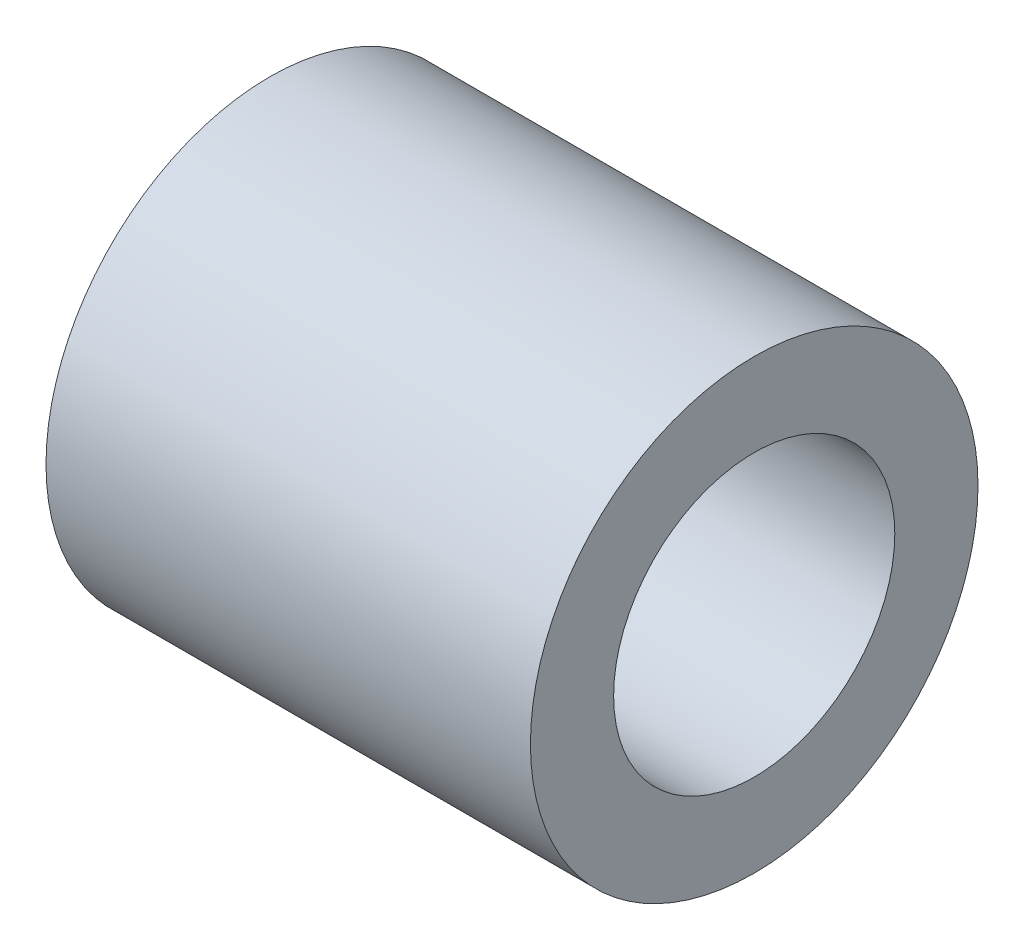
from build123d import *

# Parameters (mm, degrees)
SKETCH1_R           = 5.3975
SKETCH1_R_2         = 3.3909
BOSS_EXTRUDE1_DEPTH = 11.684


with BuildPart() as part:
    # Sketch1 → Boss-Extrude1 (new body)
    with BuildSketch(Plane(origin=(0, 0, 0), x_dir=(0, 0, -1), z_dir=(1, 0, 0))):
        Circle(SKETCH1_R)
        Circle(SKETCH1_R_2, mode=Mode.SUBTRACT)
    extrude(amount=BOSS_EXTRUDE1_DEPTH)


solid = part.part
